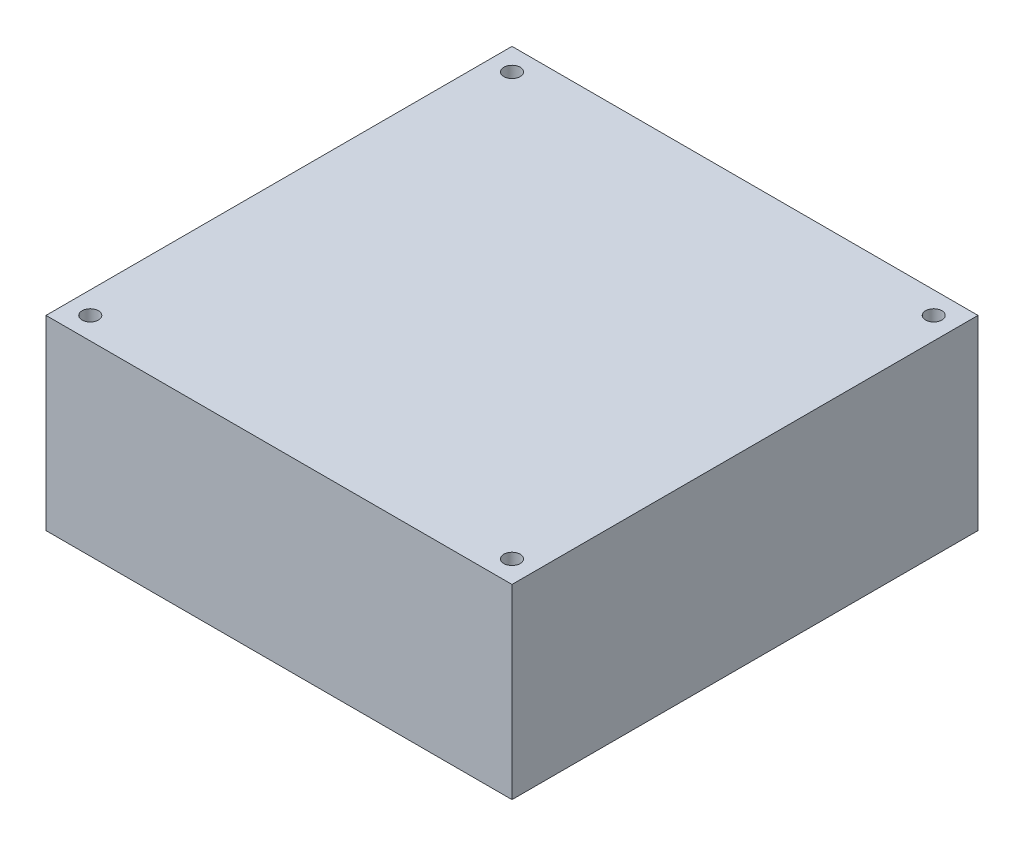
from build123d import *

# Parameters (mm, degrees)
ESBO_O1_W                = 100
ESBO_O1_H                = 100
ESBO_O1_R                = 1.75
RESSALTO_EXTRUS_O1_DEPTH = 40


with BuildPart() as part:
    # Esboço1 → Ressalto-extrusão1 (new body)
    with BuildSketch(Plane(origin=(0, 40, 0), x_dir=(1, 0, 0), z_dir=(0, 1, 0))):
        with Locations((50, 50)):
            Rectangle(ESBO_O1_W, ESBO_O1_H)
        with Locations((4.75, 95.25)):
            Circle(ESBO_O1_R, mode=Mode.SUBTRACT)
        with Locations((95.25, 95.25)):
            Circle(ESBO_O1_R, mode=Mode.SUBTRACT)
        with Locations((95.25, 4.75)):
            Circle(ESBO_O1_R, mode=Mode.SUBTRACT)
        with Locations((4.75, 4.75)):
            Circle(ESBO_O1_R, mode=Mode.SUBTRACT)
    extrude(amount=-RESSALTO_EXTRUS_O1_DEPTH)


solid = part.part
